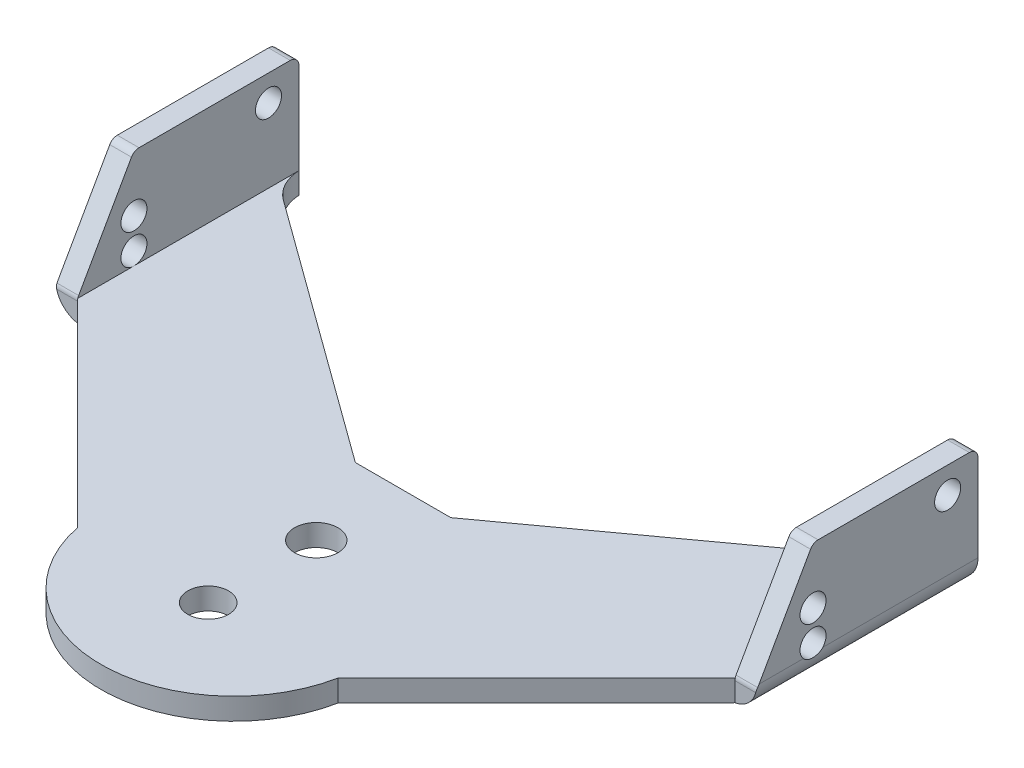
from build123d import *

# Parameters (mm, degrees)
SKETCH1_R           = 2.35
SKETCH1_R_2         = 2.5
BOSS_EXTRUDE1_DEPTH = 2.5
SKETCH2_R           = 1.5
BOSS_EXTRUDE2_DEPTH = 2.5
FILLET1_R           = 5
FILLET2_R           = 1
FILLET3_R           = 3


with BuildPart() as part:
    # Sketch1 → Boss-Extrude1 (new body)
    with BuildSketch(Plane(origin=(0, 0, 0), x_dir=(1, 0, 0), z_dir=(0, 1, 0))):
        with BuildLine():
            Line((-5.5, 0), (5.5, 0))
            Line((5.5, 0), (37.860679775, 23.511410092))
            Line((37.860679775, 23.511410092), (37.860679775, 0.360679775))
            Line((37.860679775, 0.360679775), (15, -22.5))
            ThreePointArc((15, -22.5), (0, -34.8), (-15, -22.5))
            Line((-15, -22.5), (-37.860679775, 0.360679775))
            Line((-37.860679775, 0.360679775), (-37.860679775, 23.511410092))
            Line((-37.860679775, 23.511410092), (-5.5, 0))
        make_face()
        with Locations(Location((0, -22.45, 0), (0, 0, 270))):
            Circle(SKETCH1_R, mode=Mode.SUBTRACT)
        with Locations(Location((0, -10, 0), (0, 0, 270))):
            Circle(SKETCH1_R_2, mode=Mode.SUBTRACT)
    extrude(amount=BOSS_EXTRUDE1_DEPTH)

    # Sketch2 → Boss-Extrude2 (add)
    with BuildSketch(Plane(origin=(37.860679775, 0, 0), x_dir=(0, 0, -1), z_dir=(1, 0, 0))):
        Polygon((0.360679775, 0), (25.860679775, 0), (25.860679775, 14), (6.860679775, 14), (0.360679775, 2.5), align=None)
        with Locations((6.860679775, 7.5)):
            Circle(SKETCH2_R, mode=Mode.SUBTRACT)
        with Locations((22.360679775, 11)):
            Circle(SKETCH2_R, mode=Mode.SUBTRACT)
        with Locations(Location((6.860679775, 4, 0), (0, 0, 270))):
            Circle(SKETCH2_R, mode=Mode.SUBTRACT)
    boss_extrude2 = extrude(amount=BOSS_EXTRUDE2_DEPTH)

    # Mirror1: Boss-Extrude2 across plane
    add(boss_extrude2.mirror(Plane(origin=(0, 0, 0), x_dir=(0, 0, 1), z_dir=(1, 0, 0))))

    # Fillet1
    # the kernel refuses this fillet: 5 mm, written as the material it adds along each edge
    with BuildSketch(Plane(origin=(37.860679775, 0, -23.511410092), x_dir=(-0.8090169943749437, 0, 0.5877852522924782), z_dir=(0, 1, 0))) as fillet1_piece_1:
        with BuildLine():
            CenterArc((2.542616315, -5), FILLET1_R, 90, 51.692614863)
            Line((-1.380866074, -1.900599098), (-1.459335721, -1.83861108))
            ThreePointArc((-1.459335721, -1.83861108), (-0.771334736, -0.891521024), (-0.080901699, 0.058778525))
            Line((-0.080901699, 0.058778525), (0, 0.1))
            Line((0, 0.1), (2.542616315, 0.1))
            Line((2.542616315, 0.1), (2.542616315, 0))
        make_face()
    extrude(amount=2.5)
    with BuildSketch(Plane(origin=(-37.860679775, 0, -23.511410092), x_dir=(0.8090169943749425, 0, 0.58778525229248), z_dir=(0, 1, 0))) as fillet1_piece_2:
        with BuildLine():
            CenterArc((2.542616315, 5), FILLET1_R, 218.307385137, 51.692614863)
            Line((-1.380866074, 1.900599098), (-1.459335721, 1.83861108))
            ThreePointArc((-1.459335721, 1.83861108), (-0.771334736, 0.891521024), (-0.080901699, -0.058778525))
            Line((-0.080901699, -0.058778525), (0, -0.1))
            Line((0, -0.1), (2.542616315, -0.1))
            Line((2.542616315, -0.1), (2.542616315, 0))
        make_face()
    extrude(amount=2.5)

    # Fillet2
    fillet2_edges = [part.edges().sort_by_distance(p)[0] for p in [
        (39.110679775, 2.5, -0.360679775),
        (39.110679775, 14, -25.860679775),
        (39.110679775, 14, -6.860679775),
        (-39.110679775, 2.5, -0.360679775),
        (-39.110679775, 14, -6.860679775),
        (-39.110679775, 14, -25.860679775),
    ]]
    fillet(fillet2_edges, radius=FILLET2_R)

    # Fillet3
    # the kernel refuses this fillet: 3 mm, written as the material it takes off along each edge
    with BuildSketch(Plane(origin=(-40.360679775, 0, 7.139320225), x_dir=(1, 0, 0), z_dir=(0, 0, -1)), Plane(origin=(40.360679775, 0, 7.139320225), x_dir=(0, 1, 0), z_dir=(0, 0, -1))) as fillet3_piece_1:
        with BuildLine():
            CenterArc((FILLET3_R, -FILLET3_R), FILLET3_R, 90, 90)
            Line((0, -FILLET3_R), (0, 0))
            Line((0, 0), (FILLET3_R, 0))
        make_face()
    extrude(amount=40.5, mode=Mode.SUBTRACT)


solid = part.part
